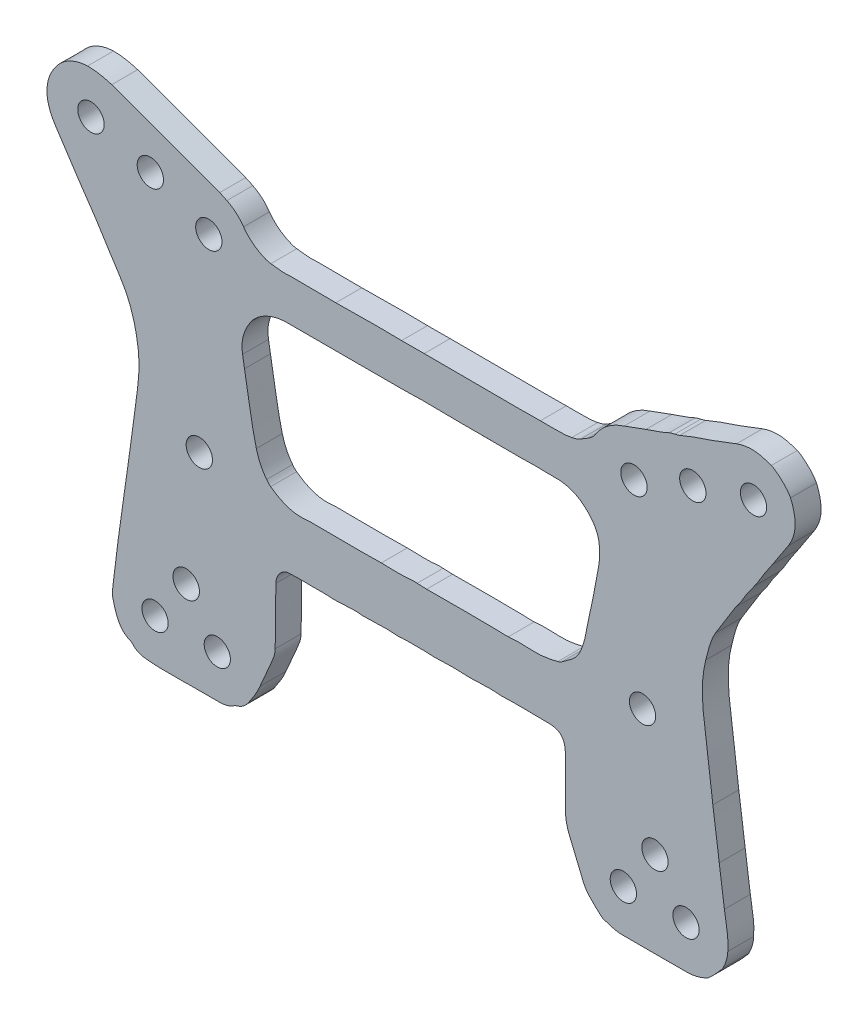
from build123d import *

# Parameters (mm, degrees)
MODEL_R             = 1.52412229
MODEL_R_2           = 1.521299729
MODEL_R_3           = 1.530374467
MODEL_R_4           = 1.523528179
MODEL_R_5           = 1.523647216
MODEL_R_6           = 1.523213372
MODEL_R_7           = 1.515164041
MODEL_R_8           = 1.514991583
MODEL_R_9           = 1.531030084
MODEL_R_10          = 1.520246581
MODEL_R_11          = 1.52200078
MODEL_R_12          = 1.515736988
MODEL_R_13          = 1.520643826
MODEL_R_14          = 1.518092937
BOSS_EXTRUDE1_DEPTH = 3


with BuildPart() as part:
    # Model → Boss-Extrude1 (new body)
    with BuildSketch(Plane.XY):
        with BuildLine():
            Line((110.320150801, 167.661366096), (97.836619162, 172.231462256))
            add(Edge.make_bspline(
                [(97.836619162, 172.231462256), (96.481090111, 172.676522539), (95.044108486, 172.705208796)],
                knots=[0.717217, 0.717217, 0.717217, 1.717217, 1.717217, 1.717217], degree=2))
            add(Edge.make_bspline(
                [(95.044108486, 172.705208796), (93.229002118, 172.610575122), (91.840961368, 171.744655318), (90.978616139, 170.205872125), (90.113956527, 168.662959161), (90.129268649, 167.019981876), (90.986881792, 165.432549994)],
                knots=[93, 93, 93, 93, 94, 94, 94, 95, 95, 95, 95], degree=3))
            add(Edge.make_bspline(
                [(90.986881792, 165.432549994), (91.160584487, 165.111006119), (91.369746832, 164.808314643), (91.567378591, 164.500017005)],
                knots=[95, 95, 95, 95, 96, 96, 96, 96], degree=3))
            add(Edge.make_bspline(
                [(91.567378591, 164.500017005), (91.764876034, 164.191967152), (91.96854172, 163.887871554), (92.169262767, 163.581886587), (92.72567552, 162.733673172), (93.27496948, 161.880700197), (93.840009508, 161.038258135)],
                knots=[96, 96, 96, 96, 97, 97, 97, 98, 98, 98, 98], degree=3))
            add(Edge.make_bspline(
                [(93.840009508, 161.038258135), (94.561714654, 159.962246618), (95.296159237, 158.894752752), (96.024828196, 157.823387227)],
                knots=[98, 98, 98, 98, 99, 99, 99, 99], degree=3))
            add(Edge.make_bspline(
                [(96.024828196, 157.823387227), (96.056516642, 157.776803423), (96.085301778, 157.728247655), (96.115378422, 157.680559139), (96.595912482, 156.918688885), (97.074194152, 156.155383536), (97.557641855, 155.395361355)],
                knots=[99, 99, 99, 99, 100, 100, 100, 101, 101, 101, 101], degree=3))
            add(Edge.make_bspline(
                [(97.557641855, 155.395361355), (97.965655143, 154.753935837), (98.373337806, 154.112159289), (98.792199763, 153.477816326)],
                knots=[101, 101, 101, 101, 102, 102, 102, 102], degree=3))
            add(Edge.make_bspline(
                [(98.792199763, 153.477816326), (100.050438767, 151.572247629), (100.628765832, 149.43136465), (100.905262252, 147.203962994)],
                knots=[102, 102, 102, 102, 103, 103, 103, 103], degree=3))
            add(Edge.make_bspline(
                [(100.905262252, 147.203962994), (101.065212967, 145.915402552), (100.983207358, 144.612986732), (100.823907564, 143.323651957), (100.623599799, 141.702428234), (100.399590275, 140.084126323), (100.181945304, 138.46507073), (100.028162833, 137.321083203), (99.870206207, 136.177632546), (99.709955863, 135.034522595)],
                knots=[103, 103, 103, 103, 104, 104, 104, 105, 105, 105, 106, 106, 106, 106], degree=3))
            add(Edge.make_bspline(
                [(99.709955863, 135.034522595), (99.569181463, 134.030276153), (99.420957643, 133.027093126), (99.27901572, 132.023011875)],
                knots=[106, 106, 106, 106, 107, 107, 107, 107], degree=3))
            add(Edge.make_bspline(
                [(99.27901572, 132.023011875), (99.038454226, 130.321422832), (98.788759185, 128.621000449), (98.564357043, 126.917274251)],
                knots=[107, 107, 107, 107, 108, 108, 108, 108], degree=3))
            add(Edge.make_bspline(
                [(98.564357043, 126.917274251), (98.347476644, 125.270755688), (98.163359227, 123.619952489), (97.952130469, 121.972669919), (97.897608156, 121.547489471), (97.880301946, 121.129205739), (97.99739525, 120.715857081)],
                knots=[108, 108, 108, 108, 109, 109, 109, 110, 110, 110, 110], degree=3))
            add(Edge.make_bspline(
                [(97.99739525, 120.715857081), (98.135524641, 120.228337759), (98.247865195, 119.727912905), (98.444081462, 119.26376808)],
                knots=[110, 110, 110, 110, 111, 111, 111, 111], degree=3))
            add(Edge.make_bspline(
                [(98.444081462, 119.26376808), (98.732728391, 118.580931295), (99.130419946, 117.968940712), (99.865153827, 117.66275958)],
                knots=[111, 111, 111, 111, 112, 112, 112, 112], degree=3))
            add(Edge.make_bspline(
                [(99.865153827, 117.66275958), (100.016301621, 117.599780591), (100.167470079, 117.499200048), (100.275626147, 117.37772287)],
                knots=[112, 112, 112, 112, 113, 113, 113, 113], degree=3))
            add(Edge.make_bspline(
                [(100.275626147, 117.37772287), (100.634779095, 116.974388904), (101.098709525, 116.779876747), (101.61097336, 116.719045238)],
                knots=[113, 113, 113, 113, 114, 114, 114, 114], degree=3))
            add(Edge.make_bspline(
                [(101.61097336, 116.719045238), (102.224946053, 116.646092855), (102.844498062, 116.599777487), (103.462603581, 116.586479629)],
                knots=[114, 114, 114, 114, 115, 115, 115, 115], degree=3))
            add(Edge.make_bspline(
                [(103.462603581, 116.586479629), (104.44811737, 116.565252612), (105.434416395, 116.580821844), (106.420384794, 116.580821844)],
                knots=[115, 115, 115, 115, 116, 116, 116, 116], degree=3))
            add(Edge.make_bspline(
                [(106.420384794, 116.580821844), (106.420426122, 116.586686117), (106.420467451, 116.592571039), (106.420508779, 116.598435312)],
                knots=[0, 0, 0, 0, 1, 1, 1, 1], degree=3))
            add(Edge.make_bspline(
                [(106.420508779, 116.598435312), (107.660139732, 116.598435312), (108.899812013, 116.605373325), (110.139370642, 116.595647717), (110.802544633, 116.590444208), (111.427903263, 116.688071965), (111.980596473, 117.090167), (112.091314892, 117.170718159), (112.234341683, 117.213481926), (112.368369244, 117.254345997)],
                knots=[1, 1, 1, 1, 2, 2, 2, 3, 3, 3, 4, 4, 4, 4], degree=3))
            add(Edge.make_bspline(
                [(112.368369244, 117.254345997), (112.936322915, 117.427527893), (113.359668989, 117.803130455), (113.680934251, 118.272437493)],
                knots=[4, 4, 4, 4, 5, 5, 5, 5], degree=3))
            add(Edge.make_bspline(
                [(113.680934251, 118.272437493), (114.173319191, 118.991698847), (114.650908612, 119.719612068), (114.98410741, 120.538318278)],
                knots=[5, 5, 5, 5, 6, 6, 6, 6], degree=3))
            add(Edge.make_bspline(
                [(114.98410741, 120.538318278), (115.461655503, 121.711627171), (116.007209255, 122.857245957), (116.488652537, 124.029078457), (116.635419535, 124.386303543), (116.729255359, 124.789214207), (116.739670081, 125.174119075)],
                knots=[6, 6, 6, 6, 7, 7, 7, 8, 8, 8, 8], degree=3))
            add(Edge.make_bspline(
                [(116.739670081, 125.174119075), (116.777743745, 126.582360246), (116.768506878, 127.991860997), (116.780946685, 129.400835202), (116.787910498, 130.189817394), (116.789832262, 130.97918159), (116.817573859, 131.767533992)],
                knots=[8, 8, 8, 8, 9, 9, 9, 10, 10, 10, 10], degree=3))
            add(Edge.make_bspline(
                [(116.817573859, 131.767533992), (116.839539832, 132.392068752), (117.102046634, 132.917984609), (117.607336324, 133.291057686)],
                knots=[10, 10, 10, 10, 11, 11, 11, 11], degree=3))
            add(Edge.make_bspline(
                [(117.607336324, 133.291057686), (117.779075926, 133.417872592), (118.00843746, 133.520600615), (118.217506817, 133.533041547), (118.863477919, 133.571479379), (119.514222435, 133.595906967), (120.159656269, 133.561351119), (121.087734102, 133.511659664), (122.012763976, 133.635119131), (122.943755452, 133.540619674), (123.583362001, 133.475699693), (124.239262218, 133.515913326), (124.883394212, 133.566306842)],
                knots=[11, 11, 11, 11, 12, 12, 12, 13, 13, 13, 14, 14, 14, 15, 15, 15, 15], degree=3))
            add(Edge.make_bspline(
                [(124.883394212, 133.566306842), (125.527825836, 133.616731331), (126.164839036, 133.654983324), (126.805396135, 133.539742098), (126.940901182, 133.515366132), (127.086273351, 133.5477745), (127.227171736, 133.550851179), (127.564358711, 133.558212493), (127.901607679, 133.562858484), (128.238804987, 133.570095906), (129.109591514, 133.588793439), (129.980099075, 133.655003973), (130.850782281, 133.544790742), (131.042938046, 133.520466398), (131.243721085, 133.568289132), (131.440784581, 133.577725656)],
                knots=[15, 15, 15, 15, 16, 16, 16, 17, 17, 17, 18, 18, 18, 19, 19, 19, 20, 20, 20, 20], degree=3))
            add(Edge.make_bspline(
                [(131.440784581, 133.577725656), (131.665754988, 133.588514679), (131.891737936, 133.608915742), (132.116026426, 133.598322882), (132.987494869, 133.557159402), (133.859169954, 133.629688484), (134.732477505, 133.555507494)],
                knots=[20, 20, 20, 20, 21, 21, 21, 22, 22, 22, 22], degree=3))
            add(Edge.make_bspline(
                [(134.732477505, 133.555507494), (135.290574385, 133.508097737), (135.858187098, 133.585427676), (136.42134669, 133.581359853)],
                knots=[22, 22, 22, 22, 23, 23, 23, 23], degree=3))
            add(Edge.make_bspline(
                [(136.42134669, 133.581359853), (137.208154184, 133.575691744), (137.9939698, 133.634964265), (138.782864371, 133.554000128)],
                knots=[23, 23, 23, 23, 24, 24, 24, 24], degree=3))
            add(Edge.make_bspline(
                [(138.782864371, 133.554000128), (139.255070786, 133.505547604), (139.737929561, 133.559595966), (140.215963261, 133.569579685)],
                knots=[24, 24, 24, 24, 25, 25, 25, 25], degree=3))
            add(Edge.make_bspline(
                [(140.215963261, 133.569579685), (141.114894336, 133.588370137), (142.014228361, 133.645939128), (142.911557966, 133.534383722)],
                knots=[25, 25, 25, 25, 26, 26, 26, 26], degree=3))
            add(Edge.make_bspline(
                [(142.911557966, 133.534383722), (142.966875847, 133.52751798), (143.024260142, 133.535529733), (143.080569902, 133.538492843)],
                knots=[26, 26, 26, 26, 27, 27, 27, 27], degree=3))
            add(Edge.make_bspline(
                [(143.080569902, 133.538492843), (144.853004837, 133.631970182), (146.625315788, 133.518959032), (148.397719727, 133.534394046)],
                knots=[27, 27, 27, 27, 28, 28, 28, 28], degree=3))
            add(Edge.make_bspline(
                [(148.397719727, 133.534394046), (148.538287485, 133.535612328), (148.680239741, 133.525133038), (148.819505659, 133.505609551)],
                knots=[28, 28, 28, 28, 29, 29, 29, 29], degree=3))
            add(Edge.make_bspline(
                [(148.819505659, 133.505609551), (149.626904961, 133.392474508), (150.083509956, 132.970019708), (150.238232645, 132.161111377)],
                knots=[29, 29, 29, 29, 30, 30, 30, 30], degree=3))
            add(Edge.make_bspline(
                [(150.238232645, 132.161111377), (150.290740205, 131.886636553), (150.299780763, 131.600794537), (150.300700317, 131.320052787)],
                knots=[30, 30, 30, 30, 31, 31, 31, 31], degree=3))
            add(Edge.make_bspline(
                [(150.300700317, 131.320052787), (150.306486273, 129.57297433), (150.32472237, 127.825534519), (150.296670811, 126.078900012), (150.281431013, 125.129961512), (150.440524166, 124.237146583), (150.821942717, 123.367623555)],
                knots=[31, 31, 31, 31, 32, 32, 32, 33, 33, 33, 33], degree=3))
            add(Edge.make_bspline(
                [(150.821942717, 123.367623555), (151.342358552, 122.18126459), (151.853392871, 120.989351085), (152.318273851, 119.780546821), (152.744306262, 118.672756726), (153.646636587, 117.990787194), (154.464739909, 117.22775028)],
                knots=[33, 33, 33, 33, 34, 34, 34, 35, 35, 35, 35], degree=3))
            add(Edge.make_bspline(
                [(154.464739909, 117.22775028), (154.563545457, 117.135615116), (154.707750103, 117.083476773), (154.839390956, 117.036500642)],
                knots=[35, 35, 35, 35, 36, 36, 36, 36], degree=3))
            add(Edge.make_bspline(
                [(154.839390956, 117.036500642), (155.531226099, 116.789581706), (156.229746089, 116.582638943), (156.978087301, 116.58860646)],
                knots=[36, 36, 36, 36, 37, 37, 37, 37], degree=3))
            add(Edge.make_bspline(
                [(156.978087301, 116.58860646), (158.076995514, 116.597361572), (159.176058709, 116.583196462), (160.27505991, 116.583547492)],
                knots=[37, 37, 37, 37, 38, 38, 38, 38], degree=3))
            add(Edge.make_bspline(
                [(160.27505991, 116.583547492), (161.655475595, 116.583960469), (163.035880948, 116.589370467), (164.416296633, 116.592220009)],
                knots=[38, 38, 38, 38, 39, 39, 39, 39], degree=3))
            add(Edge.make_bspline(
                [(164.416296633, 116.592220009), (165.222166789, 116.593892565), (165.972398769, 116.82646055), (166.688390283, 117.169355335)],
                knots=[39, 39, 39, 39, 40, 40, 40, 40], degree=3))
            add(Edge.make_bspline(
                [(166.688390283, 117.169355335), (167.017197953, 117.326844106), (168.363765789, 118.765366814), (168.54029947, 119.094220381)],
                knots=[40, 40, 40, 40, 41, 41, 41, 41], degree=3))
            add(Edge.make_bspline(
                [(168.54029947, 119.094220381), (168.86495365, 119.699045815), (169.04808952, 120.345561274), (169.090316674, 121.030215157)],
                knots=[41, 41, 41, 41, 42, 42, 42, 42], degree=3))
            add(Edge.make_bspline(
                [(169.090316674, 121.030215157), (169.137358571, 121.792756498), (169.093023676, 122.55098223), (168.971084632, 123.305181436), (168.876649548, 123.889254776), (168.778463925, 124.472904815), (168.69667529, 125.058795254)],
                knots=[42, 42, 42, 42, 43, 43, 43, 44, 44, 44, 44], degree=3))
            add(Edge.make_bspline(
                [(168.69667529, 125.058795254), (168.494104803, 126.509635), (168.300275244, 127.961682704), (168.102447175, 129.413172889)],
                knots=[44, 44, 44, 44, 45, 45, 45, 45], degree=3))
            add(Edge.make_bspline(
                [(168.102447175, 129.413172889), (167.855221498, 131.227163941), (167.598221687, 133.039864439), (167.362226967, 134.855311235)],
                knots=[45, 45, 45, 45, 46, 46, 46, 46], degree=3))
            add(Edge.make_bspline(
                [(167.362226967, 134.855311235), (167.03898828, 137.34184562), (166.757615125, 139.834068763), (166.409548484, 142.317030897), (166.097995364, 144.539507803), (165.975632706, 146.746539369), (166.541385647, 148.948367425)],
                knots=[46, 46, 46, 46, 47, 47, 47, 48, 48, 48, 48], degree=3))
            add(Edge.make_bspline(
                [(166.541385647, 148.948367425), (166.829030366, 150.067803471), (167.068310684, 151.207681877), (167.664119605, 152.213528605)],
                knots=[48, 48, 48, 48, 49, 49, 49, 49], degree=3))
            add(Edge.make_bspline(
                [(167.664119605, 152.213528605), (168.410487392, 153.473562663), (169.195176813, 154.711161746), (169.976828606, 155.949948139)],
                knots=[49, 49, 49, 49, 50, 50, 50, 50], degree=3))
            add(Edge.make_bspline(
                [(169.976828606, 155.949948139), (170.216832168, 156.330320584), (170.544317334, 156.659618102), (170.755825058, 157.053061269), (171.171866362, 157.826969802), (171.676277826, 158.535338888), (172.211571836, 159.226362941)],
                knots=[50, 50, 50, 50, 51, 51, 51, 52, 52, 52, 52], degree=3))
            add(Edge.make_bspline(
                [(172.211571836, 159.226362941), (172.314995818, 159.359847425), (172.418161497, 159.496119503), (172.500694041, 159.642777952), (173.039955564, 160.601039408), (173.655302422, 161.509010592), (174.280289098, 162.412965575)],
                knots=[52, 52, 52, 52, 53, 53, 53, 54, 54, 54, 54], degree=3))
            add(Edge.make_bspline(
                [(174.280289098, 162.412965575), (174.905069132, 163.316610825), (175.483106899, 164.252426982), (176.087801397, 165.170103125)],
                knots=[54, 54, 54, 54, 55, 55, 55, 55], degree=3))
            add(Edge.make_bspline(
                [(176.087801397, 165.170103125), (177.135886178, 166.760673632), (177.062032569, 168.414636104), (176.342796787, 170.087956873)],
                knots=[55, 55, 55, 55, 56, 56, 56, 56], degree=3))
            add(Edge.make_bspline(
                [(176.342796787, 170.087956873), (176.053374953, 170.761357134), (174.805715985, 171.941614364), (174.131466018, 172.231462256)],
                knots=[56, 56, 56, 56, 57, 57, 57, 57], degree=3))
            add(Edge.make_bspline(
                [(174.131466018, 172.231462256), (173.823281152, 172.363955595), (173.488687525, 172.435503856), (173.165345518, 172.532274687), (172.125888013, 172.843370244), (171.101267354, 172.752886988), (170.097744775, 172.386277)],
                knots=[57, 57, 57, 57, 58, 58, 58, 59, 59, 59, 59], degree=3))
            add(Edge.make_bspline(
                [(170.097744775, 172.386277), (169.174471352, 172.048978054), (168.272099699, 171.651797445), (167.340756933, 171.33993788), (166.058712849, 170.910648311), (164.775056963, 170.490898511), (163.53447546, 169.949124338)],
                knots=[59, 59, 59, 59, 60, 60, 60, 61, 61, 61, 61], degree=3))
            add(Edge.make_bspline(
                [(163.53447546, 169.949124338), (163.355524076, 169.87095812), (163.155732915, 169.840573339), (162.96572622, 169.787547095)],
                knots=[61, 61, 61, 61, 62, 62, 62, 62], degree=3))
            add(Edge.make_bspline(
                [(162.96572622, 169.787547095), (162.748546191, 169.726953048), (162.516012713, 169.697239354), (162.317110109, 169.599394784)],
                knots=[62, 62, 62, 62, 63, 63, 63, 63], degree=3))
            add(Edge.make_bspline(
                [(162.317110109, 169.599394784), (161.453370051, 169.174462122), (160.52174832, 168.935431047), (159.627900621, 168.593950708)],
                knots=[63, 63, 63, 63, 64, 64, 64, 64], degree=3))
            add(Edge.make_bspline(
                [(159.627900621, 168.593950708), (158.786064543, 168.272365535), (157.946294879, 167.941601949), (157.090365863, 167.661366096)],
                knots=[64, 64, 64, 64, 65, 65, 65, 65], degree=3))
            add(Edge.make_bspline(
                [(157.090365863, 167.661366096), (155.761083573, 167.226129659), (154.658559136, 166.501107276), (153.895339749, 165.310742435)],
                knots=[65, 65, 65, 65, 66, 66, 66, 66], degree=3))
            add(Edge.make_bspline(
                [(153.895339749, 165.310742435), (153.630280926, 164.897331831), (153.28913677, 164.573526907), (152.865284424, 164.329736272)],
                knots=[66, 66, 66, 66, 67, 67, 67, 67], degree=3))
            add(Edge.make_bspline(
                [(152.865284424, 164.329736272), (152.596506058, 164.175128016), (152.330062738, 164.015977013), (152.068165528, 163.850022214)],
                knots=[67, 67, 67, 67, 68, 68, 68, 68], degree=3))
            add(Edge.make_bspline(
                [(152.068165528, 163.850022214), (151.752789544, 163.650192979), (151.408277133, 163.558935391), (151.043131587, 163.484093639)],
                knots=[68, 68, 68, 68, 69, 69, 69, 69], degree=3))
            add(Edge.make_bspline(
                [(151.043131587, 163.484093639), (149.839518216, 163.237381192), (148.622865778, 163.390636948), (147.414602978, 163.350650453)],
                knots=[69, 69, 69, 69, 70, 70, 70, 70], degree=3))
            add(Edge.make_bspline(
                [(147.414602978, 163.350650453), (145.557682738, 163.289220127), (143.696712329, 163.35321091), (141.837446711, 163.357908523), (141.048459151, 163.359901137), (140.259419931, 163.339964673), (139.470422039, 163.341461715), (137.638340086, 163.344941046), (135.806278798, 163.357681386), (133.974196845, 163.362038293)],
                knots=[70, 70, 70, 70, 71, 71, 71, 72, 72, 72, 73, 73, 73, 73], degree=3))
            add(Edge.make_bspline(
                [(133.974196845, 163.362038293), (133.101271581, 163.364123826), (132.228294656, 163.349070816), (131.35541072, 163.353851024)],
                knots=[73, 73, 73, 73, 74, 74, 74, 74], degree=3))
            add(Edge.make_bspline(
                [(131.35541072, 163.353851024), (130.45355567, 163.358786099), (129.55170062, 163.392629562), (128.649959224, 163.38844817), (127.015757, 163.380870043), (125.381658097, 163.34261805), (123.747476538, 163.339252288)],
                knots=[74, 74, 74, 74, 75, 75, 75, 76, 76, 76, 76], degree=3))
            add(Edge.make_bspline(
                [(123.747476538, 163.339252288), (122.142824006, 163.335938119), (120.538130146, 163.360365679), (118.933446617, 163.371712194), (118.764259034, 163.372909824), (118.594141564, 163.378629552), (118.425987188, 163.364247626), (117.688866592, 163.301196352), (116.961520129, 163.396583698), (116.23554783, 163.498537377)],
                knots=[76, 76, 76, 76, 77, 77, 77, 78, 78, 78, 79, 79, 79, 79], degree=3))
            add(Edge.make_bspline(
                [(116.23554783, 163.498537377), (116.014710251, 163.529562282), (115.789874164, 163.580792085), (115.584658671, 163.665689836), (114.573562704, 164.083994259), (113.713149596, 164.708167699), (113.079566678, 165.609304141)],
                knots=[79, 79, 79, 79, 80, 80, 80, 84.927019549, 84.927019549, 84.927019549, 84.927019549], degree=3))
            add(Edge.make_bspline(
                [(113.079566678, 165.609304141), (112.56305088, 166.34391525), (111.925419779, 166.899843265), (111.152321138, 167.270423273)],
                knots=[81, 81, 81, 81, 81.747112382, 81.747112382, 81.747112382, 81.747112382], degree=3))
            add(Edge.make_bspline(
                [(110.320150801, 167.661366096), (110.758594986, 167.488060669), (111.152321138, 167.270423273)],
                knots=[0, 0, 0, 0.240751021, 0.240751021, 0.240751021], degree=2))
        make_face()
        with BuildLine():
            Line((138.316234628, 158.528584214), (142.695907083, 158.529123584))
            add(Edge.make_bspline(
                [(142.695907083, 158.529123584), (142.007285729, 158.526420239), (141.318643814, 158.5236116), (140.630006975, 158.522583064)],
                knots=[33, 33, 33, 33, 33.498742461, 33.498742461, 33.498742461, 33.498742461], degree=3))
            Line((140.630006975, 158.522583064), (145.304772006, 158.513110544))
            add(Edge.make_bspline(
                [(149.523656625, 158.504561779), (148.708611594, 158.547242949), (147.889082447, 158.499946761), (147.073334836, 158.534564556), (146.48459261, 158.559549574), (145.89437225, 158.521093265), (145.304772006, 158.513110544)],
                knots=[29, 29, 29, 29, 30, 30, 30, 30.537059777, 30.537059777, 30.537059777, 30.537059777], degree=3))
            add(Edge.make_bspline(
                [(154.239449209, 154.201238423), (154.177849431, 154.943605839), (153.941110802, 155.652883474), (153.504694664, 156.249026066), (152.524243588, 157.588320731), (151.218167118, 158.415833675), (149.523656625, 158.504561779)],
                knots=[27, 27, 27, 27, 28, 28, 28, 29, 29, 29, 29], degree=3))
            add(Edge.make_bspline(
                [(154.161297461, 152.180067145), (154.282399607, 152.853426108), (154.295356018, 153.52743551), (154.239449209, 154.201238423)],
                knots=[26, 26, 26, 26, 27, 27, 27, 27], degree=3))
            add(Edge.make_bspline(
                [(152.944676019, 146.047689402), (153.412987245, 148.079484512), (153.792349715, 150.128531736), (154.161297461, 152.180067145)],
                knots=[25, 25, 25, 25, 26, 26, 26, 26], degree=3))
            add(Edge.make_bspline(
                [(152.696613446, 144.804298317), (152.77995189, 145.218648443), (152.849796657, 145.636033951), (152.944676019, 146.047689402)],
                knots=[24, 24, 24, 24, 25, 25, 25, 25], degree=3))
            add(Edge.make_bspline(
                [(152.521991197, 143.977208674), (152.597973211, 144.247935732), (152.641047594, 144.528006394), (152.696613446, 144.804298317)],
                knots=[23, 23, 23, 23, 24, 24, 24, 24], degree=3))
            add(Edge.make_bspline(
                [(149.883522485, 140.439647879), (151.616767894, 141.620380033), (151.958015372, 141.967931133), (152.521991197, 143.977208674)],
                knots=[22, 22, 22, 22, 23, 23, 23, 23], degree=3))
            add(Edge.make_bspline(
                [(149.422825992, 140.233386528), (149.584223196, 140.268210811), (149.746126671, 140.346067296), (149.883522485, 140.439647879)],
                knots=[21, 21, 21, 21, 22, 22, 22, 22], degree=3))
            add(Edge.make_bspline(
                [(143.714824441, 139.859188088), (144.814455899, 139.974336394), (145.912816513, 139.878236651), (147.009503332, 139.866126101), (147.845470796, 139.856896066), (148.627019269, 140.061619078), (149.422825992, 140.233386528)],
                knots=[19, 19, 19, 19, 20, 20, 20, 21, 21, 21, 21], degree=3))
            add(Edge.make_bspline(
                [(134.249773711, 139.898297008), (135.123143255, 139.899917942), (135.99652313, 139.926761446), (136.869830681, 139.923519577), (138.700879427, 139.916715781), (140.531886845, 139.898534469), (142.36288393, 139.881715982), (142.813919942, 139.877575888), (143.269884349, 139.812604285), (143.714824441, 139.859188088)],
                knots=[16, 16, 16, 16, 17, 17, 17, 18, 18, 18, 19, 19, 19, 19], degree=3))
            add(Edge.make_bspline(
                [(133.152911247, 139.942619762), (133.518563065, 139.927422209), (133.884173554, 139.89762592), (134.249773711, 139.898297008)],
                knots=[15, 15, 15, 15, 16, 16, 16, 16], degree=3))
            add(Edge.make_bspline(
                [(129.015828015, 139.914372137), (130.226673832, 139.90121882), (131.437488652, 139.803807875), (132.646825988, 139.957156551), (132.812252697, 139.978135782), (132.98409562, 139.949630046), (133.152911247, 139.942619762)],
                knots=[13, 13, 13, 13, 14, 14, 14, 15, 15, 15, 15], degree=3))
            add(Edge.make_bspline(
                [(116.214181202, 141.151289808), (117.45428743, 140.231383589), (118.812272199, 139.690445695), (120.394628115, 139.892525654), (120.617273807, 139.920959119), (120.845126859, 139.915600743), (121.070510548, 139.914413434), (122.845631821, 139.90506983), (124.620742761, 139.887301496), (126.395864033, 139.8840906), (127.269181916, 139.882510963), (128.142716773, 139.923849958), (129.015828015, 139.914372137)],
                knots=[9, 9, 9, 9, 10, 10, 10, 11, 11, 11, 12, 12, 12, 13, 13, 13, 13], degree=3))
            add(Edge.make_bspline(
                [(115.751593941, 141.640450714), (115.88976466, 141.464223113), (116.036469666, 141.283122384), (116.214181202, 141.151289808)],
                knots=[8, 8, 8, 8, 9, 9, 9, 9], degree=3))
            add(Edge.make_bspline(
                [(114.558653594, 144.137732825), (114.791806997, 143.220159926), (115.168968736, 142.383468569), (115.751593941, 141.640450714)],
                knots=[7, 7, 7, 7, 8, 8, 8, 8], degree=3))
            add(Edge.make_bspline(
                [(113.190936018, 151.445102342), (113.653895234, 149.010747598), (113.946902295, 146.545192443), (114.558653594, 144.137732825)],
                knots=[6, 6, 6, 6, 7, 7, 7, 7], degree=3))
            add(Edge.make_bspline(
                [(112.967918373, 152.779234794), (113.040707778, 152.3342521), (113.106709016, 151.887937555), (113.190936018, 151.445102342)],
                knots=[5, 5, 5, 5, 6, 6, 6, 6], degree=3))
            add(Edge.make_bspline(
                [(113.882388875, 156.461430451), (113.122548073, 155.36191022), (112.745778952, 154.13696888), (112.967918373, 152.779234794)],
                knots=[4, 4, 4, 4, 5, 5, 5, 5], degree=3))
            add(Edge.make_bspline(
                [(116.146082554, 158.170318861), (115.232335297, 157.825266272), (114.438057719, 157.265486302), (113.882388875, 156.461430451)],
                knots=[3, 3, 3, 3, 4, 4, 4, 4], degree=3))
            add(Edge.make_bspline(
                [(118.38404939, 158.526129501), (117.603895746, 158.561748766), (116.859821677, 158.439848286), (116.146082554, 158.170318861)],
                knots=[2, 2, 2, 2, 3, 3, 3, 3], degree=3))
            Line((118.38404939, 158.526129501), (131.585373288, 158.527755287))
            add(Edge.make_bspline(
                [(133.737396224, 158.57449943), (133.019965385, 158.569976824), (132.302646907, 158.536586899), (131.585373288, 158.527755287)],
                knots=[35, 35, 35, 35, 35.54214012, 35.54214012, 35.54214012, 35.54214012], degree=3))
            add(Edge.make_bspline(
                [(138.316234628, 158.528584214), (136.789891499, 158.541706613), (135.263508456, 158.584128301), (133.737396224, 158.57449943)],
                knots=[34.049306511, 34.049306511, 34.049306511, 34.049306511, 35, 35, 35, 35], degree=3))
        make_face(mode=Mode.SUBTRACT)
        with Locations((102.299531169, 165.681930641)):
            Circle(MODEL_R, mode=Mode.SUBTRACT)
        with Locations((109.062560603, 162.844296694)):
            Circle(MODEL_R_2, mode=Mode.SUBTRACT)
        with Locations((95.430949602, 167.788804283)):
            Circle(MODEL_R_3, mode=Mode.SUBTRACT)
        with Locations((158.238672278, 162.842421441)):
            Circle(MODEL_R_4, mode=Mode.SUBTRACT)
        with Locations((165.04344007, 165.658779657)):
            Circle(MODEL_R_5, mode=Mode.SUBTRACT)
        with Locations((172.064631277, 167.751827586)):
            Circle(MODEL_R_6, mode=Mode.SUBTRACT)
        with Locations((102.842831118, 121.531389095)):
            Circle(MODEL_R_7, mode=Mode.SUBTRACT)
        with Locations((110.042569052, 121.522038603)):
            Circle(MODEL_R_8, mode=Mode.SUBTRACT)
        with Locations((106.448038266, 126.519931479)):
            Circle(MODEL_R_9, mode=Mode.SUBTRACT)
        with Locations((107.961692274, 140.462735924)):
            Circle(MODEL_R_10, mode=Mode.SUBTRACT)
        with Locations((157.011878504, 121.500752449)):
            Circle(MODEL_R_11, mode=Mode.SUBTRACT)
        with Locations((164.255390392, 121.51299388)):
            Circle(MODEL_R_12, mode=Mode.SUBTRACT)
        with Locations((160.662868844, 126.513842203)):
            Circle(MODEL_R_13, mode=Mode.SUBTRACT)
        with Locations((159.226704497, 140.40777198)):
            Circle(MODEL_R_14, mode=Mode.SUBTRACT)
    extrude(amount=BOSS_EXTRUDE1_DEPTH)


solid = part.part
